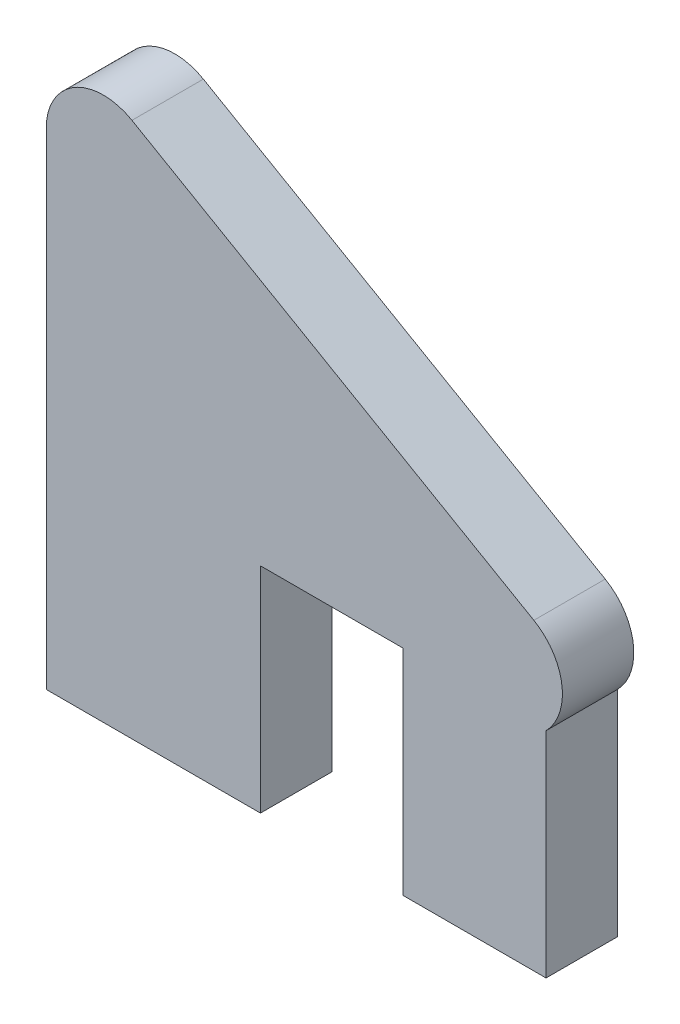
from build123d import *

# Parameters (mm, degrees)
SKETCH1_W           = 9.525
SKETCH1_H           = 9.525
SKETCH1_W_2         = 6.35
BOSS_EXTRUDE1_DEPTH = 3.175
FILLET1_R           = 2.54


with BuildPart() as part:
    # Sketch1 → Boss-Extrude1 (new body)
    with BuildSketch(Plane.XY):
        with Locations((4.7625, -4.7625)):
            Rectangle(SKETCH1_W, SKETCH1_H)
        Polygon((28.575, 0), (0, 16.497783942), (0, 0), align=None)
        with Locations((19.05, -4.7625)):
            Rectangle(SKETCH1_W_2, SKETCH1_H)
    extrude(amount=BOSS_EXTRUDE1_DEPTH)

    # Fillet1
    # the kernel refuses this fillet: 2.54 mm, written as the material it takes off along each edge
    with BuildSketch(Plane(origin=(28.575, 0, -19.896514347), x_dir=(-0.8660254037844417, 0.4999999999999948, 0), z_dir=(0, 0, 1))) as fillet1_piece_1:
        with BuildLine():
            CenterArc((7.958605739, 2.54), FILLET1_R, 165.522487814, 104.477512186)
            Line((5.499261314, 3.175), (5.450074426, 3.1877))
            ThreePointArc((5.450074426, 3.1877), (2.724230657, 1.631494091), (-0.0254, 0.043994091))
            Line((-0.0254, 0.043994091), (0, -0.0508))
            Line((0, -0.0508), (7.958605739, -0.0508))
            Line((7.958605739, -0.0508), (7.958605739, 0))
        make_face()
    extrude(amount=42.968028694, mode=Mode.SUBTRACT)
    with BuildSketch(Plane(origin=(0, 16.497783942, -10.998522628), x_dir=(0, -1, 0), z_dir=(0, 0, 1))) as fillet1_piece_2:
        with BuildLine():
            CenterArc((FILLET1_R * 1.73205080757, FILLET1_R), FILLET1_R, 150, 120)
            Line((FILLET1_R * 0.866025403784, FILLET1_R * 1.5), (FILLET1_R * 0.848704895709, FILLET1_R * 1.51))
            Line((FILLET1_R * 0.848704895709, FILLET1_R * 1.51), (-FILLET1_R * 0.0346410161514, -FILLET1_R * 0.02))
            Line((-FILLET1_R * 0.0346410161514, -FILLET1_R * 0.02), (FILLET1_R * 1.73205080757, -FILLET1_R * 0.02))
            Line((FILLET1_R * 1.73205080757, -FILLET1_R * 0.02), (FILLET1_R * 1.73205080757, 0))
        make_face()
    extrude(amount=25.172045256, mode=Mode.SUBTRACT)


solid = part.part
